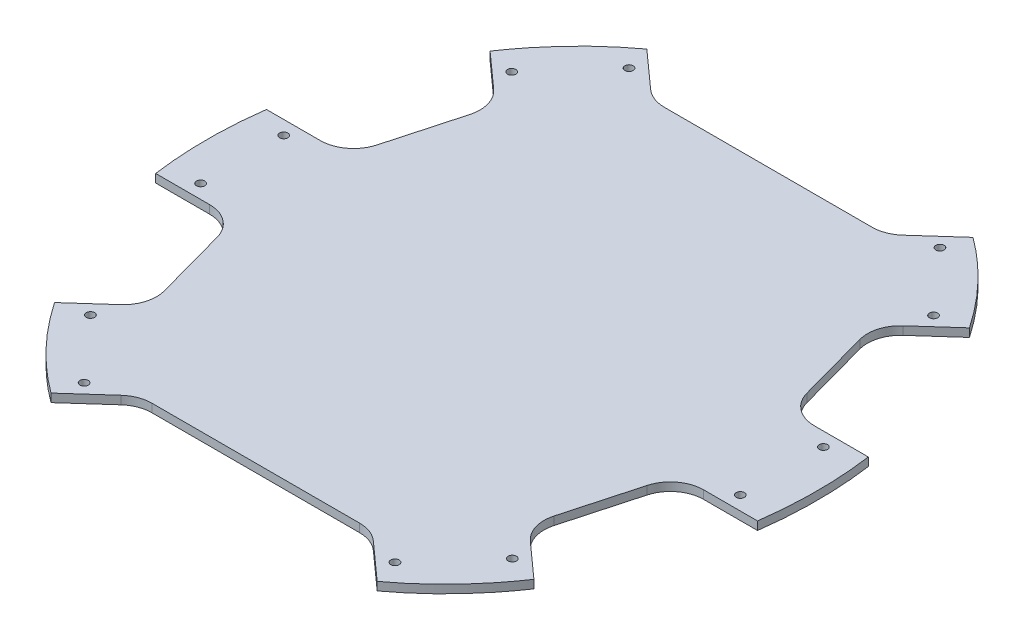
from build123d import *

# Parameters (mm, degrees)
SKETCH2_R               = 1.5
BOSS_EXTRUDE1_DEPTH     = 3
SKETCH7_R               = 1.5
CUT_EXTRUDE4_DEPTH      = 10
MIRROR2_COPY_1_SKETCH_R = 1.5
MIRROR2_COPY_1_DEPTH    = 10
CUT_EXTRUDE5_START      = -10
SKETCH8_R               = 1.5
CUT_EXTRUDE5_DEPTH      = 10
CUT_EXTRUDE6_START      = -3
CUT_EXTRUDE6_OUTLINE_R  = 1.5
CUT_EXTRUDE6_DEPTH      = 3
SKETCH10_W              = 79.739042834
SKETCH10_H              = 30
BOSS_EXTRUDE2_DEPTH     = 19


# Read off the part's stored shape, not the designer's step: Cut-Extrude6
with BuildPart() as part:
    # Sketch2 → Boss-Extrude1 (new body)
    with BuildSketch(Plane(origin=(0, 0, 0), x_dir=(1, 0, 0), z_dir=(0, 1, 0))):
        with BuildLine():
            Line((77.604131862, 28.818122204), (70.352023373, 55.1894258))
            ThreePointArc((70.352023373, 55.1894258), (70.409142384, 61.75403485), (73.912058214, 67.306235788))
            Line((73.912058214, 67.306235788), (89.448492578, 81.235106792))
            ThreePointArc((89.448492578, 81.235106792), (90.603066053, 81.737789877), (91.829194878, 81.450843369))
            ThreePointArc((91.829194878, 81.450843369), (98.283456403, 82.511045735), (98.166159929, 89.050752337))
            Line((98.166159929, 89.050752337), (71.464727022, 118.833859641))
            ThreePointArc((71.464727022, 118.833859641), (64.976597411, 119.661926694), (63.220516764, 113.361315481))
            ThreePointArc((63.220516764, 113.361315481), (63.372367291, 112.111246838), (62.747059671, 111.018214097))
            Line((62.747059671, 111.018214097), (45.510429872, 95.565067809))
            ThreePointArc((45.510429872, 95.565067809), (41.788403765, 93.292431435), (37.5, 92.5))
            Line((37.5, 92.5), (-37.5, 92.5))
            ThreePointArc((-37.5, 92.5), (-41.788403765, 93.292431435), (-45.510429872, 95.565067809))
            Line((-45.510429872, 95.565067809), (-62.747059671, 111.018214097))
            ThreePointArc((-62.747059671, 111.018214097), (-63.372367291, 112.111246838), (-63.220516764, 113.361315481))
            ThreePointArc((-63.220516764, 113.361315481), (-64.976597411, 119.661926694), (-71.464727022, 118.833859641))
            Line((-71.464727022, 118.833859641), (-98.166159929, 89.050752337))
            ThreePointArc((-98.166159929, 89.050752337), (-98.283456403, 82.511045735), (-91.829194878, 81.450843369))
            ThreePointArc((-91.829194878, 81.450843369), (-90.603066053, 81.737789877), (-89.448492578, 81.235106792))
            Line((-89.448492578, 81.235106792), (-73.912058214, 67.306235788))
            ThreePointArc((-73.912058214, 67.306235788), (-70.409142384, 61.75403485), (-70.352023373, 55.1894258))
            Line((-70.352023373, 55.1894258), (-77.604131862, 28.818122204))
            ThreePointArc((-77.604131862, 28.818122204), (-81.900757615, 22.455825506), (-89.174596575, 20))
            Line((-89.174596575, 20), (-110.791796068, 20))
            ThreePointArc((-110.791796068, 20), (-111.987024677, 20.396432549), (-112.708425763, 21.428571429))
            ThreePointArc((-112.708425763, 21.428571429), (-118.221847911, 24.947619184), (-122.5, 20))
            Line((-122.5, 20), (-122.5, -20))
            ThreePointArc((-122.5, -20), (-118.221847911, -24.947619184), (-112.708425762, -21.428571429))
            ThreePointArc((-112.708425762, -21.428571429), (-111.987024677, -20.396432549), (-110.791796067, -20))
            Line((-110.791796067, -20), (-89.174596575, -20))
            ThreePointArc((-89.174596575, -20), (-81.900757615, -22.455825506), (-77.604131862, -28.818122204))
            Line((-77.604131862, -28.818122204), (-70.352023373, -55.1894258))
            ThreePointArc((-70.352023373, -55.1894258), (-70.409142384, -61.75403485), (-73.912058214, -67.306235788))
            Line((-73.912058214, -67.306235788), (-89.448492578, -81.235106792))
            ThreePointArc((-89.448492578, -81.235106792), (-90.603066053, -81.737789877), (-91.829194878, -81.450843369))
            ThreePointArc((-91.829194878, -81.450843369), (-98.283456403, -82.511045735), (-98.166159929, -89.050752337))
            Line((-98.166159929, -89.050752337), (-71.464727022, -118.833859641))
            ThreePointArc((-71.464727022, -118.833859641), (-64.976597411, -119.661926694), (-63.220516764, -113.361315481))
            ThreePointArc((-63.220516764, -113.361315481), (-63.372367291, -112.111246838), (-62.747059671, -111.018214097))
            Line((-62.747059671, -111.018214097), (-45.510429872, -95.565067809))
            ThreePointArc((-45.510429872, -95.565067809), (-41.788403765, -93.292431435), (-37.5, -92.5))
            Line((-37.5, -92.5), (37.5, -92.5))
            ThreePointArc((37.5, -92.5), (41.788403765, -93.292431435), (45.510429872, -95.565067809))
            Line((45.510429872, -95.565067809), (62.747059671, -111.018214097))
            ThreePointArc((62.747059671, -111.018214097), (63.372367291, -112.111246838), (63.220516764, -113.361315481))
            ThreePointArc((63.220516764, -113.361315481), (64.976597411, -119.661926694), (71.464727022, -118.833859641))
            Line((71.464727022, -118.833859641), (98.166159929, -89.050752337))
            ThreePointArc((98.166159929, -89.050752337), (98.283456403, -82.511045735), (91.829194878, -81.450843369))
            ThreePointArc((91.829194878, -81.450843369), (90.603066053, -81.737789877), (89.448492578, -81.235106792))
            Line((89.448492578, -81.235106792), (73.912058214, -67.306235788))
            ThreePointArc((73.912058214, -67.306235788), (70.409142384, -61.75403485), (70.352023373, -55.1894258))
            Line((70.352023373, -55.1894258), (77.604131862, -28.818122204))
            ThreePointArc((77.604131862, -28.818122204), (81.900757615, -22.455825506), (89.174596575, -20))
            Line((89.174596575, -20), (110.791796067, -20))
            ThreePointArc((110.791796067, -20), (111.987024677, -20.396432549), (112.708425762, -21.428571429))
            ThreePointArc((112.708425762, -21.428571429), (118.221847911, -24.947619184), (122.5, -20))
            Line((122.5, -20), (122.5, 20))
            ThreePointArc((122.5, 20), (118.221847911, 24.947619184), (112.708425763, 21.428571429))
            ThreePointArc((112.708425763, 21.428571429), (111.987024677, 20.396432549), (110.791796068, 20))
            Line((110.791796068, 20), (89.174596575, 20))
            ThreePointArc((89.174596575, 20), (81.900757615, 22.455825506), (77.604131862, 28.818122204))
        make_face()
        with Locations(Location((-91.038580411, 89.375883412, 0), (0, 0, 270))):
            Circle(SKETCH2_R, mode=Mode.SUBTRACT)
        with Locations(Location((-71.012505731, 111.713213891, 0), (0, 0, 90))):
            Circle(SKETCH2_R, mode=Mode.SUBTRACT)
        with Locations(Location((91.038580411, 89.375883412, 0), (0, 0, 90))):
            Circle(SKETCH2_R, mode=Mode.SUBTRACT)
        with Locations(Location((71.012505731, 111.713213891, 0), (0, 0, 270))):
            Circle(SKETCH2_R, mode=Mode.SUBTRACT)
        with Locations(Location((91.038580411, -89.375883412, 0), (0, 0, 270))):
            Circle(SKETCH2_R, mode=Mode.SUBTRACT)
        with Locations(Location((71.012505731, -111.713213891, 0), (0, 0, 90))):
            Circle(SKETCH2_R, mode=Mode.SUBTRACT)
        with Locations(Location((-71.012505731, -111.713213891, 0), (0, 0, 270))):
            Circle(SKETCH2_R, mode=Mode.SUBTRACT)
        with Locations(Location((-91.038580411, -89.375883412, 0), (0, 0, 90))):
            Circle(SKETCH2_R, mode=Mode.SUBTRACT)
        with Locations(Location((-117.41, -15, 0), (0, 0, 270))):
            Circle(SKETCH2_R, mode=Mode.SUBTRACT)
        with Locations(Location((-117.41, 15, 0), (0, 0, 90))):
            Circle(SKETCH2_R, mode=Mode.SUBTRACT)
        with Locations(Location((117.41, -15, 0), (0, 0, 90))):
            Circle(SKETCH2_R, mode=Mode.SUBTRACT)
        with Locations(Location((117.41, 15, 0), (0, 0, 270))):
            Circle(SKETCH2_R, mode=Mode.SUBTRACT)
    extrude(amount=BOSS_EXTRUDE1_DEPTH)

    # Sketch7 → Cut-Extrude4 (cut)
    with BuildSketch(Plane(origin=(0, 3, 0), x_dir=(1, 0, 0), z_dir=(0, 1, 0))):
        with Locations(Location((-76.147026759, 76.025166959, 0), (0, 0, 270))):
            Circle(SKETCH7_R)
        with Locations(Location((-56.120952079, 98.362497437, 0), (0, 0, 270))):
            Circle(SKETCH7_R)
    cut_extrude4 = extrude(amount=-CUT_EXTRUDE4_DEPTH, mode=Mode.SUBTRACT)

    # Mirror1: Cut-Extrude4 across plane
    add(cut_extrude4.mirror(Plane(origin=(0, 0, 0), x_dir=(0, 0, 1), z_dir=(1, 0, 0))), mode=Mode.SUBTRACT)

    # Mirror2: Cut-Extrude4 across plane
    add(cut_extrude4.mirror(Plane.XY), mode=Mode.SUBTRACT)

    # Mirror2 copy 1 sketch → Mirror2 copy 1 (cut)
    with BuildSketch(Plane(origin=(0, 3, 0), x_dir=(-1, 0, 0), z_dir=(0, 1, 0))):
        with Locations(Location((-76.147026759, 76.025166959, 0), (0, 0, 270))):
            Circle(MIRROR2_COPY_1_SKETCH_R)
        with Locations(Location((-56.120952079, 98.362497437, 0), (0, 0, 270))):
            Circle(MIRROR2_COPY_1_SKETCH_R)
    extrude(amount=-MIRROR2_COPY_1_DEPTH, mode=Mode.SUBTRACT)

    # Sketch8 → Cut-Extrude5 (cut)
    with BuildSketch(Plane(origin=(0, 3, 0), x_dir=(1, 0, 0), z_dir=(0, 1, 0)).offset(CUT_EXTRUDE5_START)):
        with Locations(Location((-117.41, 15, 0), (0, 0, 90))):
            Circle(SKETCH8_R)
        with Locations(Location((-117.41, -15, 0), (0, 0, 270))):
            Circle(SKETCH8_R)
        with Locations(Location((-97.41, -15, 0), (0, 0, 270))):
            Circle(SKETCH8_R)
        with Locations(Location((-97.41, 15, 0), (0, 0, 270))):
            Circle(SKETCH8_R)
    cut_extrude5 = extrude(amount=CUT_EXTRUDE5_DEPTH, mode=Mode.SUBTRACT)

    # Mirror3: Cut-Extrude5 across plane
    add(cut_extrude5.mirror(Plane(origin=(0, 0, 0), x_dir=(0, 0, 1), z_dir=(1, 0, 0))), mode=Mode.SUBTRACT)

    # Cut-Extrude6 outline → Cut-Extrude6 (cut)
    # profile 1 of 6: a face of its own
    with BuildSketch(Plane(origin=(0, 3, 0), x_dir=(1, 0, 0), z_dir=(0, 1, 0)).offset(CUT_EXTRUDE6_START)):
        with BuildLine():
            add(Edge.make_bspline(
                [(86.522808724, 78.612145047), (74.844785146, 95.828075633), (58.86921899, 107.541615712)],
                knots=[5.377949175, 5.377949175, 5.377949175, 5.718470743, 5.718470743, 5.718470743], degree=2, weights=[1, 0.985540613, 1]))
            Line((86.522808724, 78.612145047), (89.448492578, 81.235106792))
            ThreePointArc((89.448492578, 81.235106792), (90.603066053, 81.737789877), (91.829194878, 81.450843369))
            ThreePointArc((91.829194878, 81.450843369), (98.283456403, 82.511045736), (98.166159929, 89.050752337))
            Line((98.166159929, 89.050752337), (71.464727022, 118.833859641))
            ThreePointArc((71.464727022, 118.833859641), (64.976597411, 119.661926694), (63.220516764, 113.361315481))
            ThreePointArc((63.220516764, 113.361315481), (63.372367291, 112.111246838), (62.747059671, 111.018214097))
            Line((62.747059671, 111.018214097), (58.86921899, 107.541615712))
        make_face()
        with Locations((91.038580411, 89.375883412)):
            Circle(CUT_EXTRUDE6_OUTLINE_R, mode=Mode.SUBTRACT)
        with Locations((71.012505731, 111.713213891)):
            Circle(CUT_EXTRUDE6_OUTLINE_R, mode=Mode.SUBTRACT)
    # profile 2 of 6: a face of its own
    with BuildSketch(Plane(origin=(0, 3, 0), x_dir=(1, 0, 0), z_dir=(0, 1, 0)).offset(CUT_EXTRUDE6_START)):
        with BuildLine():
            add(Edge.make_bspline(
                [(108.634090523, -20), (111.383083724, 0), (108.634090523, 20)],
                knots=[4.554635104, 4.554635104, 4.554635104, 4.870142857, 4.870142857, 4.870142857], degree=2, weights=[1, 0.987582641, 1]))
            Line((108.634090523, -20), (110.791796068, -20))
            ThreePointArc((110.791796068, -20), (111.987024677, -20.396432549), (112.708425762, -21.428571429))
            ThreePointArc((112.708425762, -21.428571429), (118.221847911, -24.947619184), (122.5, -20))
            Line((122.5, -20), (122.5, 20))
            ThreePointArc((122.5, 20), (118.221847911, 24.947619184), (112.708425763, 21.428571429))
            ThreePointArc((112.708425763, 21.428571429), (111.987024677, 20.396432549), (110.791796068, 20))
            Line((110.791796068, 20), (108.634090523, 20))
        make_face()
        with Locations((117.41, -15)):
            Circle(CUT_EXTRUDE6_OUTLINE_R, mode=Mode.SUBTRACT)
        with Locations((117.41, 15)):
            Circle(CUT_EXTRUDE6_OUTLINE_R, mode=Mode.SUBTRACT)
    # profile 3 of 6: a face of its own
    with BuildSketch(Plane(origin=(0, 3, 0), x_dir=(1, 0, 0), z_dir=(0, 1, 0)).offset(CUT_EXTRUDE6_START)):
        with BuildLine():
            add(Edge.make_bspline(
                [(58.86921899, -107.541615712), (74.844785146, -95.828075633), (86.522808724, -78.612145047)],
                knots=[3.706307217, 3.706307217, 3.706307217, 4.046828786, 4.046828786, 4.046828786], degree=2, weights=[1, 0.985540613, 1]))
            Line((58.86921899, -107.541615712), (62.747059671, -111.018214097))
            ThreePointArc((62.747059671, -111.018214097), (63.372367291, -112.111246838), (63.220516764, -113.361315481))
            ThreePointArc((63.220516764, -113.361315481), (64.976597411, -119.661926694), (71.464727022, -118.833859641))
            Line((71.464727022, -118.833859641), (98.166159929, -89.050752337))
            ThreePointArc((98.166159929, -89.050752337), (98.283456403, -82.511045736), (91.829194878, -81.450843369))
            ThreePointArc((91.829194878, -81.450843369), (90.603066053, -81.737789877), (89.448492578, -81.235106792))
            Line((89.448492578, -81.235106792), (86.522808724, -78.612145047))
        make_face()
        with Locations((71.012505731, -111.713213891)):
            Circle(CUT_EXTRUDE6_OUTLINE_R, mode=Mode.SUBTRACT)
        with Locations((91.038580411, -89.375883412)):
            Circle(CUT_EXTRUDE6_OUTLINE_R, mode=Mode.SUBTRACT)
    # profile 4 of 6: a face of its own
    with BuildSketch(Plane(origin=(0, 3, 0), x_dir=(1, 0, 0), z_dir=(0, 1, 0)).offset(CUT_EXTRUDE6_START)):
        with BuildLine():
            add(Edge.make_bspline(
                [(-86.522808724, -78.612145047), (-74.844785146, -95.828075633), (-58.86921899, -107.541615712)],
                knots=[2.236356522, 2.236356522, 2.236356522, 2.57687809, 2.57687809, 2.57687809], degree=2, weights=[1, 0.985540613, 1]))
            Line((-86.522808724, -78.612145047), (-89.448492578, -81.235106792))
            ThreePointArc((-89.448492578, -81.235106792), (-90.603066053, -81.737789877), (-91.829194878, -81.450843369))
            ThreePointArc((-91.829194878, -81.450843369), (-98.283456403, -82.511045736), (-98.166159929, -89.050752337))
            Line((-98.166159929, -89.050752337), (-71.464727022, -118.833859641))
            ThreePointArc((-71.464727022, -118.833859641), (-64.976597411, -119.661926694), (-63.220516764, -113.361315481))
            ThreePointArc((-63.220516764, -113.361315481), (-63.372367291, -112.111246838), (-62.747059671, -111.018214097))
            Line((-62.747059671, -111.018214097), (-58.86921899, -107.541615712))
        make_face()
        with Locations((-71.012505731, -111.713213891)):
            Circle(CUT_EXTRUDE6_OUTLINE_R, mode=Mode.SUBTRACT)
        with Locations((-91.038580411, -89.375883412)):
            Circle(CUT_EXTRUDE6_OUTLINE_R, mode=Mode.SUBTRACT)
    # profile 5 of 6: a face of its own
    with BuildSketch(Plane(origin=(0, 3, 0), x_dir=(1, 0, 0), z_dir=(0, 1, 0)).offset(CUT_EXTRUDE6_START)):
        with BuildLine():
            add(Edge.make_bspline(
                [(-108.634090523, 20), (-111.383083724, 0), (-108.634090523, -20)],
                knots=[1.41304245, 1.41304245, 1.41304245, 1.728550203, 1.728550203, 1.728550203], degree=2, weights=[1, 0.987582641, 1]))
            Line((-108.634090523, 20), (-110.791796068, 20))
            ThreePointArc((-110.791796068, 20), (-111.987024677, 20.396432549), (-112.708425763, 21.428571429))
            ThreePointArc((-112.708425763, 21.428571429), (-118.221847911, 24.947619184), (-122.5, 20))
            Line((-122.5, 20), (-122.5, -20))
            ThreePointArc((-122.5, -20), (-118.221847911, -24.947619184), (-112.708425762, -21.428571429))
            ThreePointArc((-112.708425762, -21.428571429), (-111.987024677, -20.396432549), (-110.791796068, -20))
            Line((-110.791796068, -20), (-108.634090523, -20))
        make_face()
        with Locations((-117.41, -15)):
            Circle(CUT_EXTRUDE6_OUTLINE_R, mode=Mode.SUBTRACT)
        with Locations((-117.41, 15)):
            Circle(CUT_EXTRUDE6_OUTLINE_R, mode=Mode.SUBTRACT)
    # profile 6 of 6: a face of its own
    with BuildSketch(Plane(origin=(0, 3, 0), x_dir=(1, 0, 0), z_dir=(0, 1, 0)).offset(CUT_EXTRUDE6_START)):
        with BuildLine():
            add(Edge.make_bspline(
                [(-58.86921899, 107.541615712), (-74.844785146, 95.828075633), (-86.522808724, 78.612145047)],
                knots=[0.564714564, 0.564714564, 0.564714564, 0.905236132, 0.905236132, 0.905236132], degree=2, weights=[1, 0.985540613, 1]))
            Line((-58.86921899, 107.541615712), (-62.747059671, 111.018214097))
            ThreePointArc((-62.747059671, 111.018214097), (-63.372367291, 112.111246838), (-63.220516764, 113.361315481))
            ThreePointArc((-63.220516764, 113.361315481), (-64.976597411, 119.661926694), (-71.464727022, 118.833859641))
            Line((-71.464727022, 118.833859641), (-98.166159929, 89.050752337))
            ThreePointArc((-98.166159929, 89.050752337), (-98.283456403, 82.511045736), (-91.829194878, 81.450843369))
            ThreePointArc((-91.829194878, 81.450843369), (-90.603066053, 81.737789877), (-89.448492578, 81.235106792))
            Line((-89.448492578, 81.235106792), (-86.522808724, 78.612145047))
        make_face()
        with Locations((-91.038580411, 89.375883412)):
            Circle(CUT_EXTRUDE6_OUTLINE_R, mode=Mode.SUBTRACT)
        with Locations((-71.012505731, 111.713213891)):
            Circle(CUT_EXTRUDE6_OUTLINE_R, mode=Mode.SUBTRACT)
    extrude(amount=CUT_EXTRUDE6_DEPTH, mode=Mode.SUBTRACT)

    # Sketch10 → Boss-Extrude2 (add)
    with BuildSketch(Plane.XZ):
        Rectangle(SKETCH10_W, SKETCH10_H)
    extrude(amount=BOSS_EXTRUDE2_DEPTH)


solid = part.part
